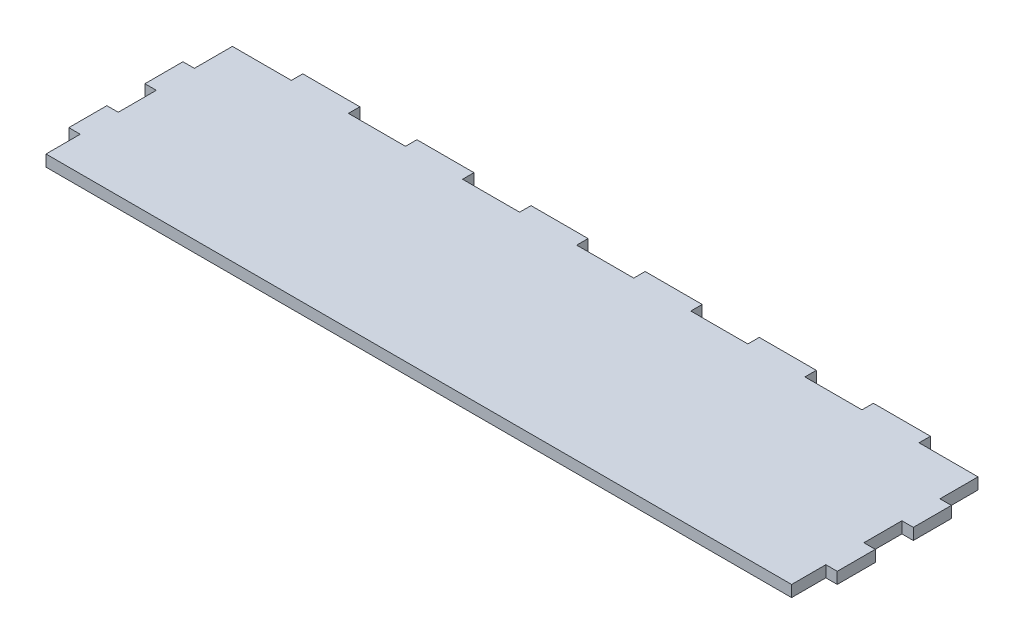
from build123d import *

# Parameters (mm, degrees)
BOSS_EXTRUDE1_DEPTH = 3


with BuildPart() as part:
    # Sketch1 → Boss-Extrude1 (new body)
    with BuildSketch(Plane(origin=(0, 0, 0), x_dir=(1, 0, 0), z_dir=(0, 1, 0))):
        Polygon((15, 0), (-0.5, 0), (-0.5, -10), (-3.5, -10), (-3.5, -20), (-0.5, -20), (-0.5, -30), (-3.5, -30), (-3.5, -40), (-0.5, -40), (-0.5, -49), (195.5, -49), (195.5, -40), (198.5, -40), (198.5, -30), (195.5, -30), (195.5, -20), (198.5, -20), (198.5, -10), (195.5, -10), (195.5, 0), (180, 0), (180, 3), (165, 3), (165, 0), (150, 0), (150, 3), (135, 3), (135, 0), (120, 0), (120, 3), (105, 3), (105, 0), (90, 0), (90, 3), (75, 3), (75, 0), (60, 0), (60, 3), (45, 3), (45, 0), (30, 0), (30, 3), (15, 3), align=None)
    extrude(amount=BOSS_EXTRUDE1_DEPTH)


solid = part.part
